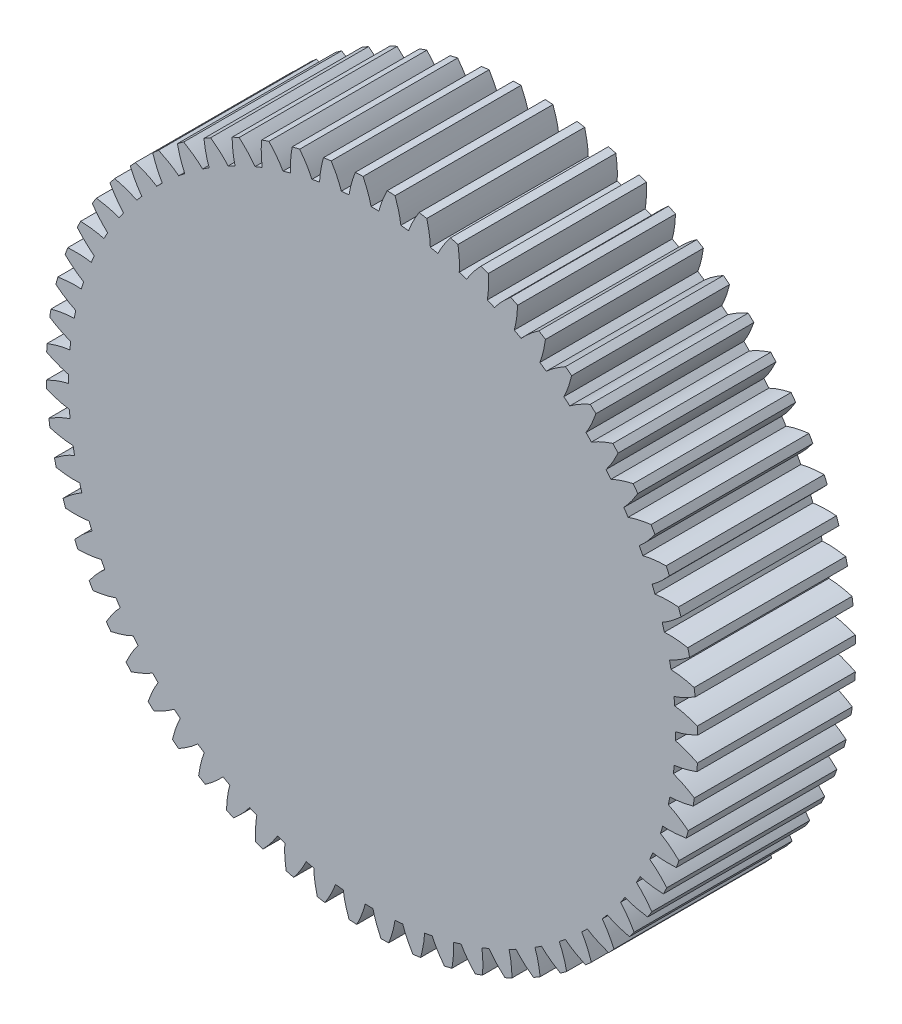
from build123d import *

# Parameters (mm, degrees)
SKETCH1_R           = 26.19375
BOSS_EXTRUDE1_DEPTH = 12.7
CUT_EXTRUDE1_DEPTH  = 40.160121018
CIRPATTERN1_COUNT   = 64
SKETCH3_R           = 24.4078125
BOSS_EXTRUDE2_DEPTH = 12.7


with BuildPart() as part:
    # Sketch1 → Boss-Extrude1 (new body)
    with BuildSketch(Plane.XY):
        Circle(SKETCH1_R)
    extrude(amount=-BOSS_EXTRUDE1_DEPTH)

    # Sketch2 → Cut-Extrude1 (cut, symmetric)
    with BuildSketch(Plane.XY):
        with BuildLine():
            Line((23.868192568, 0), (12.20390625, 0))
            ThreePointArc((12.20390625, 0), (12.203339284, -0.117635398), (12.201638437, -0.235259867))
            Line((12.201638437, -0.235259867), (23.863757218, -0.460117252))
            add(Edge.make_bspline(
                [(23.863757218, -0.460117252), (23.900511537, -0.461999471), (23.973826703, -0.467959689), (24.178391441, -0.496155447), (24.563215017, -0.579400418), (25.111550267, -0.748571843), (25.608000953, -0.95288479), (25.972286775, -1.126449334), (26.165102708, -1.224720116)],
                knots=[0, 0, 0, 0, 0, 0.002802036, 0.005604071, 0.015718253, 0.029959921, 0.04644543, 0.04644543, 0.04644543, 0.04644543, 0.04644543], degree=4))
            ThreePointArc((26.165102708, -1.224720116), (26.186587198, -0.612527556), (26.19375, 0))
            ThreePointArc((26.19375, 0), (26.191274878, 0.36008241), (26.183849979, 0.720096769))
            add(Edge.make_bspline(
                [(23.868192568, 0), (23.904976341, 0.001173341), (23.97839278, 0.005719124), (24.183463047, 0.029966162), (24.569819861, 0.105777256), (25.121314405, 0.264346754), (25.621611463, 0.459051445), (25.989175469, 0.625561243), (26.183849979, 0.720096769)],
                knots=[0, 0, 0, 0, 0, 0.002802036, 0.005604071, 0.015718253, 0.029959921, 0.04644543, 0.04644543, 0.04644543, 0.04644543, 0.04644543], degree=4))
        make_face()
    cut_extrude1 = extrude(amount=CUT_EXTRUDE1_DEPTH, both=True, mode=Mode.SUBTRACT)

    # CirPattern1: Cut-Extrude1 ×64 about axis
    cirpattern1_axis = Axis((0, 0, -12.7), (0, 0, 1))
    for i in range(1, CIRPATTERN1_COUNT):
        add(cut_extrude1.rotate(cirpattern1_axis, i * 360 / CIRPATTERN1_COUNT), mode=Mode.SUBTRACT)

    # Sketch3 → Boss-Extrude2 (add)
    with BuildSketch(Plane.XY):
        Circle(SKETCH3_R)
    extrude(amount=-BOSS_EXTRUDE2_DEPTH)


solid = part.part
